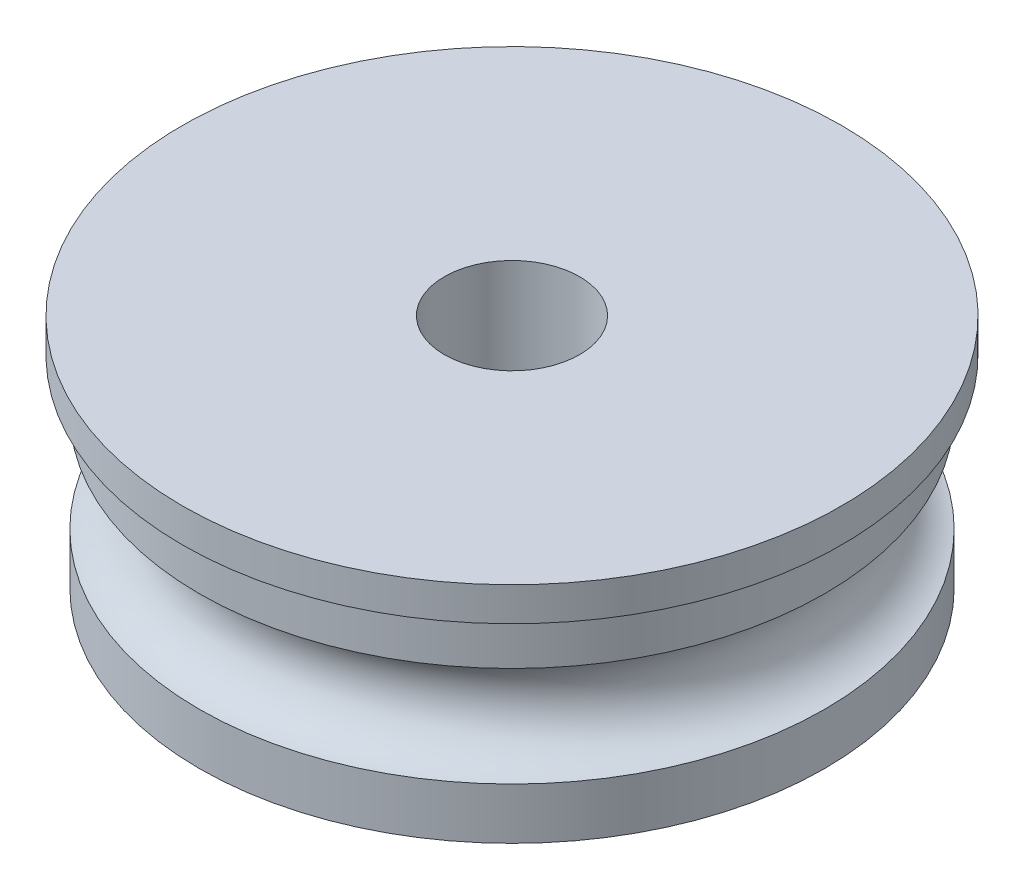
from build123d import *


with BuildPart() as part:
    # Sketch1 → Revolve1 (revolve)
    with BuildSketch(Plane.XY):
        with BuildLine():
            Line((-9.75, 6.980351381), (-2, 6.980351381))
            Line((-2, 6.980351381), (-2, 3))
            Line((-2, 3), (-6, 3))
            Line((-6, 3), (-6, 0))
            Line((-6, 0), (-9.25, 0))
            Line((-9.25, 0), (-9.25, 1.519648619))
            ThreePointArc((-9.25, 1.519648619), (-7.991991297, 3), (-9.25, 4.480351381))
            Line((-9.25, 4.480351381), (-9.25, 5.980351381))
            Line((-9.25, 5.980351381), (-9.75, 5.980351381))
            Line((-9.75, 5.980351381), (-9.75, 6.980351381))
        make_face()
    revolve(axis=Axis((0, 0, 0), (0, -1, 0)))


solid = part.part
